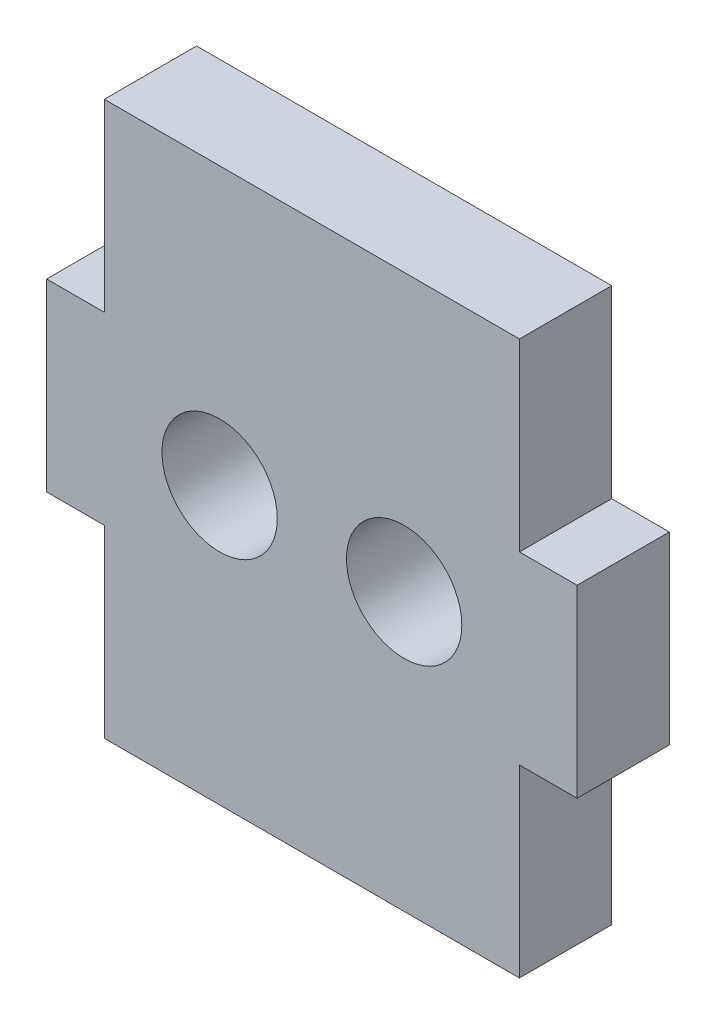
from build123d import *

# Parameters (mm, degrees)
MODEL_R             = 1.25
BOSS_EXTRUDE1_DEPTH = 2


with BuildPart() as part:
    # Model → Boss-Extrude1 (new body)
    with BuildSketch(Plane.XY):
        Polygon((1.25, 4), (0, 4), (0, 8), (1.25, 8), (1.25, 12), (10.25072, 12), (10.25072, 8), (11.50072, 8), (11.50072, 4), (10.25072, 4), (10.25072, 0), (1.25, 0), align=None)
        with Locations((7.75072, 6)):
            Circle(MODEL_R, mode=Mode.SUBTRACT)
        with Locations((3.75, 6)):
            Circle(MODEL_R, mode=Mode.SUBTRACT)
    extrude(amount=BOSS_EXTRUDE1_DEPTH)


solid = part.part
